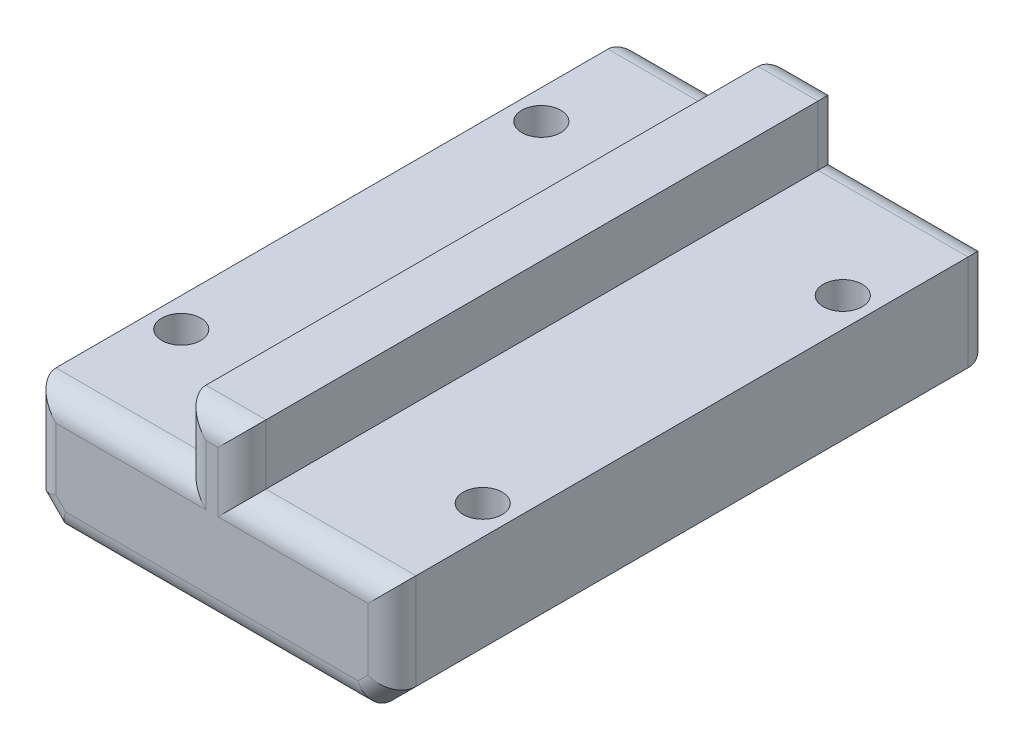
from build123d import *

# Parameters (mm, degrees)
SKETCH1_W           = 30
SKETCH1_H           = 50
BOSS_EXTRUDE1_DEPTH = 10
SKETCH2_W           = 5
SKETCH2_H           = 50
BOSS_EXTRUDE2_DEPTH = 5
SKETCH3_R           = 1.625
CUT_EXTRUDE1_DEPTH  = 33.787192622
SKETCH4_R           = 2.7
CUT_EXTRUDE2_DEPTH  = 1.45
CHAMFER1_SIZE       = 2
CHAMFER2_SIZE       = 2
FILLET1_R           = 2
FILLET2_R           = 2
CUT_EXTRUDE6_DEPTH  = 1


with BuildPart() as part:
    # Sketch1 → Boss-Extrude1 (new body)
    with BuildSketch(Plane(origin=(0, 0, 0), x_dir=(1, 0, 0), z_dir=(0, 1, 0))):
        Rectangle(SKETCH1_W, SKETCH1_H)
    extrude(amount=BOSS_EXTRUDE1_DEPTH)

    # Sketch2 → Boss-Extrude2 (add)
    with BuildSketch(Plane(origin=(0, 10, 0), x_dir=(1, 0, 0), z_dir=(0, 1, 0))):
        Rectangle(SKETCH2_W, SKETCH2_H)
    extrude(amount=BOSS_EXTRUDE2_DEPTH)

    # Sketch3 → Cut-Extrude1 (cut, through all)
    with BuildSketch(Plane.XZ):
        with Locations(Location((-12.56, 15, 0), (0, 0, 270))):
            Circle(SKETCH3_R)
        with Locations(Location((-12.56, -15, 0), (0, 0, 270))):
            Circle(SKETCH3_R)
        with Locations(Location((12.56, -15, 0), (0, 0, 270))):
            Circle(SKETCH3_R)
        with Locations(Location((12.56, 15, 0), (0, 0, 270))):
            Circle(SKETCH3_R)
    extrude(amount=-CUT_EXTRUDE1_DEPTH, mode=Mode.SUBTRACT)

    # Sketch4 → Cut-Extrude2 (cut)
    with BuildSketch(Plane.XZ):
        with Locations((-12.56, 15)):
            Circle(SKETCH4_R)
        with Locations((-12.56, -15)):
            Circle(SKETCH4_R)
        with Locations((12.56, -15)):
            Circle(SKETCH4_R)
        with Locations((12.56, 15)):
            Circle(SKETCH4_R)
    extrude(amount=-CUT_EXTRUDE2_DEPTH, mode=Mode.SUBTRACT)

    # Chamfer1
    # the kernel refuses this chamfer: 2 mm, written as the material it takes off along each edge
    with BuildSketch(Plane(origin=(-15, 0, -30.143365976), x_dir=(0.9996219169112968, -0.027495876610586365, 0), z_dir=(0, 0, 1)), Plane(origin=(-15, 0, 11.012661705), x_dir=(0.9996219169112968, -0.027495876610586365, 0), z_dir=(0, 0, 1))) as chamfer1_piece_1:
        Polygon((CHAMFER1_SIZE * 0.999621916911, CHAMFER1_SIZE * 0.0274958766106), (-CHAMFER1_SIZE * 0.0274958766106, CHAMFER1_SIZE * 0.999621916911), (0, 0), align=None)
    extrude(amount=19.130704271, mode=Mode.SUBTRACT)
    with BuildSketch(Plane(origin=(-15, 0, -18.987338295), x_dir=(0.9996219169112968, -0.027495876610586365, 0), z_dir=(0, 0, 1))) as chamfer1_piece_2:
        Polygon((CHAMFER1_SIZE * 0.999621916911, CHAMFER1_SIZE * 0.0274958766106), (-CHAMFER1_SIZE * 0.0274958766106, CHAMFER1_SIZE * 0.999621916911), (0, 0), align=None)
    extrude(amount=37.974676589, mode=Mode.SUBTRACT)

    # Chamfer2
    # the kernel refuses this chamfer: 2 mm, written as the material it takes off along each edge
    with BuildSketch(Plane(origin=(15, 0, 30.143365976), x_dir=(0.027495876610586494, 0.9996219169112968, 0), z_dir=(0, 0, -1)), Plane(origin=(15, 0, -11.012661705), x_dir=(0.027495876610586494, 0.9996219169112968, 0), z_dir=(0, 0, -1))) as chamfer2_piece_1:
        Polygon((CHAMFER2_SIZE * 0.999621916911, -CHAMFER2_SIZE * 0.0274958766106), (-CHAMFER2_SIZE * 0.0274958766106, -CHAMFER2_SIZE * 0.999621916911), (0, 0), align=None)
    extrude(amount=19.130704271, mode=Mode.SUBTRACT)
    with BuildSketch(Plane(origin=(15, 0, 18.987338295), x_dir=(0.027495876610586494, 0.9996219169112968, 0), z_dir=(0, 0, -1))) as chamfer2_piece_2:
        Polygon((CHAMFER2_SIZE * 0.999621916911, -CHAMFER2_SIZE * 0.0274958766106), (-CHAMFER2_SIZE * 0.0274958766106, -CHAMFER2_SIZE * 0.999621916911), (0, 0), align=None)
    extrude(amount=37.974676589, mode=Mode.SUBTRACT)

    # Fillet1
    fillet1_edges = [part.edges().sort_by_distance(p)[0] for p in [
        (-14, 1, 25),
        (-15, 6, 25),
        (-8.75, 10, 25),
        (-2.5, 12.5, 25),
        (0, 15, 25),
        (2.5, 12.5, 25),
        (8.75, 10, 25),
        (15, 6, 25),
        (14, 1, 25),
        (0, 0, 25),
    ]]
    fillet(fillet1_edges, radius=FILLET1_R)

    # Fillet2
    fillet2_edges = [part.edges().sort_by_distance(p)[0] for p in [
        (8.75, 10, -25),
        (2.5, 12.5, -25),
        (0, 15, -25),
        (-2.5, 12.5, -25),
        (-8.75, 10, -25),
        (-15, 6, -25),
        (-14, 1, -25),
        (0, 0, -25),
        (14, 1, -25),
        (15, 6, -25),
    ]]
    fillet(fillet2_edges, radius=FILLET2_R)

    # Mobious Logo → Cut-Extrude6 (cut)
    with BuildSketch(Plane.XZ):
        Polygon((-3.725461883, 6.377557531), (-4.828839221, 6.377557531), (-8.812218423, -0.467122224), (-2.322863572, -0.467122224), (-2.907811009, 0.678144172), (-7.12910045, 0.678144172), align=None)
        Polygon((-3.931176302, 2.917815032), (-3.42624091, 3.740672707), (-0.209615451, -1.888421846), (-8.569101382, -1.888421846), (-8.816410096, -0.785044508), (-1.698296177, -0.785044508), align=None)
        Polygon((-6.549359815, 1.01028133), (-3.42624091, 6.209245734), (0.127008143, 0), (3.661555886, 6.209245734), (6.636670117, 1.01028133), (5.573474433, 1.01028133), (3.661555886, 4.351328327), (0.173638389, -1.77600066), (-3.42624091, 4.514730681), (-5.421111797, 1.01028133), align=None)
        Polygon((3.97947817, 6.377557531), (5.026751575, 6.377557531), (8.972728155, -0.467122224), (2.464671994, -0.467122224), (3.194023116, 0.678144172), (7.252207561, 0.678144172), align=None)
        Polygon((3.661555886, 3.740672707), (0.426229116, -1.888421846), (8.673507182, -1.888421846), (9.111053368, -0.785044508), (1.90363267, -0.785044508), (4.055998695, 2.959823548), align=None)
    extrude(amount=-CUT_EXTRUDE6_DEPTH, mode=Mode.SUBTRACT)


solid = part.part
